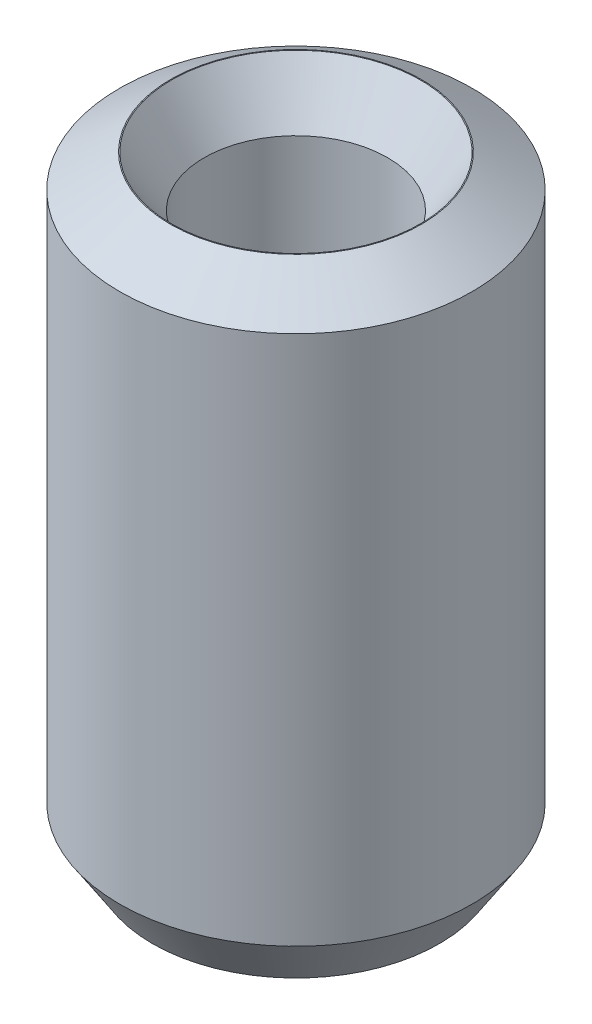
from build123d import *
from OCP.BRepFilletAPI import BRepFilletAPI_MakeChamfer

# Parameters (mm, degrees)
SKETCH1_R           = 12.5
BOSS_EXTRUDE1_DEPTH = 43.557272794
SKETCH2_R           = 6.500526562
CUT_EXTRUDE1_DEPTH  = 48.007829276
CHAMFER1_SIZE       = 2.333673086
CHAMFER1_SIZE2      = 3.599841099


with BuildPart() as part:
    # Sketch1 → Boss-Extrude1 (new body)
    with BuildSketch(Plane(origin=(0, 0, 0), x_dir=(1, 0, 0), z_dir=(0, 1, 0))):
        Circle(SKETCH1_R)
    extrude(amount=BOSS_EXTRUDE1_DEPTH)

    # Sketch2 → Cut-Extrude1 (cut, through all)
    with BuildSketch(Plane(origin=(0, 0, 0), x_dir=(1, 0, 0), z_dir=(0, 1, 0))):
        Circle(SKETCH2_R)
    extrude(amount=CUT_EXTRUDE1_DEPTH, mode=Mode.SUBTRACT)

    # Chamfer1: one chamfer whose edges measure the first distance from different faces: ONE call of the kernel's chamfer builder (chamfer() names one face for all edges)
    chamfer1_edges_1 = [part.edges().sort_by_distance(p)[0] for p in [
        (-6.500526562, 43.557272794, 0),
    ]]
    chamfer1_side_1 = [part.faces().sort_by_distance(p)[0] for p in [
        (-12.146446609, 43.557272794, 0),
    ]]
    chamfer1_edges_2 = [part.edges().sort_by_distance(p)[0] for p in [
        (-6.500526562, 0, 0),
    ]]
    chamfer1_side_2 = [part.faces().sort_by_distance(p)[0] for p in [
        (-6.500526562, 21.778636397, 0),
    ]]
    chamfer1_edges_3 = [part.edges().sort_by_distance(p)[0] for p in [
        (-12.5, 0, 0),
    ]]
    chamfer1_side_3 = [part.faces().sort_by_distance(p)[0] for p in [
        (-12.146446609, 0, 0),
    ]]
    chamfer1_edges_4 = [part.edges().sort_by_distance(p)[0] for p in [
        (-12.5, 43.557272794, 0),
    ]]
    chamfer1_side_4 = [part.faces().sort_by_distance(p)[0] for p in [
        (-12.5, 21.778636397, 0),
    ]]
    chamfer1 = BRepFilletAPI_MakeChamfer(part.part.solid().wrapped)
    for e in chamfer1_edges_1:
        chamfer1.Add(CHAMFER1_SIZE, CHAMFER1_SIZE2, e.wrapped, chamfer1_side_1[0].wrapped)  # the first distance lies on this face
    for e in chamfer1_edges_2:
        chamfer1.Add(CHAMFER1_SIZE, CHAMFER1_SIZE2, e.wrapped, chamfer1_side_2[0].wrapped)  # the first distance lies on this face
    for e in chamfer1_edges_3:
        chamfer1.Add(CHAMFER1_SIZE, CHAMFER1_SIZE2, e.wrapped, chamfer1_side_3[0].wrapped)  # the first distance lies on this face
    for e in chamfer1_edges_4:
        chamfer1.Add(CHAMFER1_SIZE, CHAMFER1_SIZE2, e.wrapped, chamfer1_side_4[0].wrapped)  # the first distance lies on this face
    add(Compound.cast(chamfer1.Shape()), mode=Mode.REPLACE)


solid = part.part
